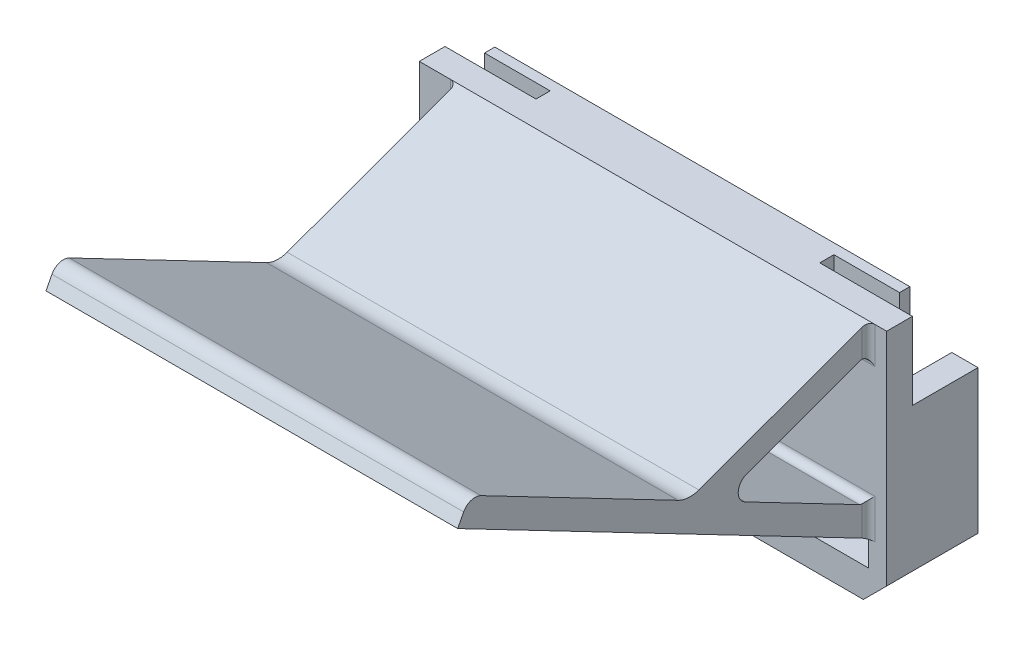
from build123d import *

# Parameters (mm, degrees)
EXTRUDE_1_DEPTH             = 7.1
EXTRUDE_2_DEPTH             = 6
EXTRUDE_2_DIRECTION_2_REACH = 25.469
SKETCH_3_W                  = 32
SKETCH_3_H                  = 2
CUT_EXTRUDE_1_DEPTH         = 36.077992299
SKETCH_4_W                  = 0.599335356
SKETCH_4_H                  = 1.1
EXTRUDE_3_DEPTH             = 4.31849548
EXTRUDE_4_DEPTH             = 32
FILLET_1_R                  = 0.5


with BuildPart() as part:
    # 草图1 → 凸台-拉伸1 (new body)
    with BuildSketch(Plane.XY):
        with BuildLine():
            Line((18.227330455, -16.15), (18.227330455, -27.306853771))
            Line((18.227330455, -27.306853771), (16.416835991, -29.117348235))
            Line((16.416835991, -29.117348235), (5.554207951, -29.117348235))
            Line((5.554207951, -29.117348235), (-15.781834721, -29.117348235))
            Line((-15.781834721, -29.117348235), (-18.100330201, -26.798852755))
            Line((-18.100330201, -26.798852755), (-18.100330201, -16.15))
            Line((-18.100330201, -16.15), (-15.809499619, -16.15))
            Line((-15.809499619, -16.15), (-15.809499619, -25.798852755))
            ThreePointArc((-15.809499619, -25.798852755), (-15.5166064, -26.505959536), (-14.809499619, -26.798852755))
            Line((-14.809499619, -26.798852755), (15.190500381, -26.798852755))
            ThreePointArc((15.190500381, -26.798852755), (15.897607162, -26.505959536), (16.190500381, -25.798852755))
            Line((16.190500381, -25.798852755), (16.190500381, -16.15))
            Line((16.190500381, -16.15), (18.227330455, -16.15))
        make_face()
    extrude(amount=EXTRUDE_1_DEPTH)

    # 草图2 → 凸台-拉伸2 (add)
    with BuildSketch(Plane(origin=(0, -16.15, 0), x_dir=(1, 0, 0), z_dir=(0, 1, 0))):
        Polygon((16.127330455, -4.000000069), (16.127330455, -3.200000069), (-16.127758191, -3.200000069), (-16.127758191, -4), (-11.027330455, -4), (-11.027330455, -5.1), (-18.100330201, -5.1), (-18.100330201, -7.1), (18.227330455, -7.1), (18.227330455, -5.100000069), (11.027330455, -5.100000069), (11.027330455, -4.000000069), align=None)
    extrude(amount=EXTRUDE_2_DEPTH)

    # 草图2 → 凸台-拉伸2 direction 2 (add, up to next)
    with BuildSketch(Plane(origin=(0, -16.15, 0), x_dir=(1, 0, 0), z_dir=(0, 1, 0)), mode=Mode.PRIVATE) as extrude_2_direction_2_sk1:
        Polygon((16.127330455, -4.000000069), (16.127330455, -3.200000069), (-16.127758191, -3.200000069), (-16.127758191, -4), (-11.027330455, -4), (-11.027330455, -5.1), (-18.100330201, -5.1), (-18.100330201, -7.1), (18.227330455, -7.1), (18.227330455, -5.100000069), (11.027330455, -5.100000069), (11.027330455, -4.000000069), align=None)
    extrude_2_direction_2_tool1 = extrude(extrude_2_direction_2_sk1.sketch, amount=-EXTRUDE_2_DIRECTION_2_REACH, mode=Mode.PRIVATE) - part.part
    add(extrude_2_direction_2_tool1.solids().sort_by_distance((0.03755, -16.15, 5.267913))[0])

    # 草图3 → 切除-拉伸1 (cut, through all)
    with BuildSketch(Plane.XY.offset(7.1)):
        with Locations((0.817500635, -25.798852755)):
            Rectangle(SKETCH_3_W, SKETCH_3_H)
    extrude(amount=-CUT_EXTRUDE_1_DEPTH, mode=Mode.SUBTRACT)

    # 草图4 → 凸台-拉伸3 (add)
    with BuildSketch(Plane.XZ.offset(29.117348235)):
        with Locations((-15.482167043, 4.55)):
            Rectangle(SKETCH_4_W, SKETCH_4_H)
    extrude(amount=-EXTRUDE_3_DEPTH)

    # 草图5 → 凸台-拉伸4 (add)
    with BuildSketch(Plane(origin=(-15.182499365, 0, 0), x_dir=(0, 0, -1), z_dir=(1, 0, 0))):
        with BuildLine():
            Line((-7.1, -24.798852755), (-39.032389994, -8.175902679))
            Line((-39.032389994, -8.175902679), (-38.570641381, -7.288891846))
            ThreePointArc((-38.570641381, -7.288891846), (-37.984336348, -6.796923508), (-37.221881935, -6.863629626))
            Line((-37.221881935, -6.863629626), (-21.892534432, -14.843582842))
            ThreePointArc((-21.892534432, -14.843582842), (-21.099843464, -15.065279022), (-20.284996919, -14.948946417))
            Line((-20.284996919, -14.948946417), (-7.1, -10.15))
            Line((-7.1, -10.15), (-7.1, -12.278355545))
            Line((-7.1, -12.278355545), (-16.570152711, -15.725209246))
            ThreePointArc((-16.570152711, -15.725209246), (-17.225991491, -16.599498737), (-16.689881181, -17.5519127))
            Line((-16.689881181, -17.5519127), (-7.1, -22.544088861))
            Line((-7.1, -22.544088861), (-7.1, -24.798852755))
        make_face()
    extrude(amount=EXTRUDE_4_DEPTH)

    # 圆角1
    # the kernel refuses this fillet: 0.5 mm, written as the material it adds along each edge
    with BuildSketch(Plane(origin=(-15.182499365, -21.294088861, 7.1), x_dir=(-1, 0, 0), z_dir=(0, -1, 0))) as fillet_1_piece_1_section:
        with BuildLine():
            CenterArc((FILLET_1_R, -FILLET_1_R), FILLET_1_R, 90, 90)
            Line((0, -FILLET_1_R), (-FILLET_1_R * 0.02, -FILLET_1_R))
            Line((-FILLET_1_R * 0.02, -FILLET_1_R), (-FILLET_1_R * 0.02, FILLET_1_R * 0.02))
            Line((-FILLET_1_R * 0.02, FILLET_1_R * 0.02), (FILLET_1_R, FILLET_1_R * 0.02))
            Line((FILLET_1_R, FILLET_1_R * 0.02), (FILLET_1_R, 0))
        make_face()
    fillet_1_piece_1 = extrude(amount=4.754763894, mode=Mode.PRIVATE)
    fillet_1_piece_1 = split(fillet_1_piece_1, bisect_by=Plane(origin=(-15.182499365, -23.618510105, 7.201736565), z_dir=(-1, 0, 0)), keep=Keep.TOP, mode=Mode.PRIVATE)
    fillet_1_piece_1 = split(fillet_1_piece_1, bisect_by=Plane(origin=(-15.30597489, -24.505520938, 7.663485178), z_dir=(0, 0.8870108331782195, -0.46174861323503813)), keep=Keep.TOP, mode=Mode.PRIVATE)
    fillet_1_piece_1 = split(fillet_1_piece_1, bisect_by=Plane(origin=(-15.30597489, -22.731499272, 6.739987952), z_dir=(0, -0.8870108331782195, 0.4617486132350387)), keep=Keep.TOP, mode=Mode.PRIVATE)
    add(fillet_1_piece_1)
    with BuildSketch(Plane(origin=(-15.182499365, -22.544088861, 7.1), x_dir=(0, 1, 0), z_dir=(1, 0, 0))) as fillet_1_piece_2:
        with BuildLine():
            CenterArc((FILLET_1_R * 1.64794899742, FILLET_1_R), FILLET_1_R, 152.5, 117.5)
            Line((FILLET_1_R * 0.76093816424, FILLET_1_R * 1.46174861324), (FILLET_1_R * 0.743197947576, FILLET_1_R * 1.4709835855))
            Line((FILLET_1_R * 0.743197947576, FILLET_1_R * 1.4709835855), (-FILLET_1_R * 0.0329589799484, -FILLET_1_R * 0.02))
            Line((-FILLET_1_R * 0.0329589799484, -FILLET_1_R * 0.02), (FILLET_1_R * 1.64794899742, -FILLET_1_R * 0.02))
            Line((FILLET_1_R * 1.64794899742, -FILLET_1_R * 0.02), (FILLET_1_R * 1.64794899742, 0))
        make_face()
    extrude(amount=32)
    with BuildSketch(Plane(origin=(-15.182499365, -12.278355545, 7.1), x_dir=(0, -1, 0), z_dir=(1, 0, 0))) as fillet_1_piece_3:
        with BuildLine():
            CenterArc((FILLET_1_R * 1.42814800674, -FILLET_1_R), FILLET_1_R, 90, 110)
            Line((FILLET_1_R * 0.488455385956, -FILLET_1_R * 1.34202014333), (FILLET_1_R * 0.46966153354, -FILLET_1_R * 1.34886054619))
            Line((FILLET_1_R * 0.46966153354, -FILLET_1_R * 1.34886054619), (-FILLET_1_R * 0.0285629601348, FILLET_1_R * 0.02))
            Line((-FILLET_1_R * 0.0285629601348, FILLET_1_R * 0.02), (FILLET_1_R * 1.42814800674, FILLET_1_R * 0.02))
            Line((FILLET_1_R * 1.42814800674, FILLET_1_R * 0.02), (FILLET_1_R * 1.42814800674, 0))
        make_face()
    extrude(amount=32)
    with BuildSketch(Plane(origin=(-15.182499365, -10.15, 7.1), x_dir=(-1, 0, 0), z_dir=(0, -1, 0))) as fillet_1_piece_4_section:
        with BuildLine():
            CenterArc((FILLET_1_R, -FILLET_1_R), FILLET_1_R, 90, 90)
            Line((0, -FILLET_1_R), (-FILLET_1_R * 0.02, -FILLET_1_R))
            Line((-FILLET_1_R * 0.02, -FILLET_1_R), (-FILLET_1_R * 0.02, FILLET_1_R * 0.02))
            Line((-FILLET_1_R * 0.02, FILLET_1_R * 0.02), (FILLET_1_R, FILLET_1_R * 0.02))
            Line((FILLET_1_R, FILLET_1_R * 0.02), (FILLET_1_R, 0))
        make_face()
    fillet_1_piece_4 = extrude(amount=3.378355545, mode=Mode.PRIVATE)
    fillet_1_piece_4 = split(fillet_1_piece_4, bisect_by=Plane(origin=(-15.295687906, -12.195082425, 6.871208984), z_dir=(0, 0.9396926207859094, 0.34202014332566616)), keep=Keep.TOP, mode=Mode.PRIVATE)
    fillet_1_piece_4 = split(fillet_1_piece_4, bisect_by=Plane(origin=(-15.295687906, -10.315697184, 7.55524927), z_dir=(0, -0.9396926207859093, -0.34202014332566627)), keep=Keep.TOP, mode=Mode.PRIVATE)
    add(fillet_1_piece_4)
    with BuildSketch(Plane(origin=(16.817500635, -21.294088861, 7.1), x_dir=(1, 0, 0), z_dir=(0, -1, 0))) as fillet_1_piece_5_section:
        with BuildLine():
            CenterArc((FILLET_1_R, FILLET_1_R), FILLET_1_R, 180, 90)
            Line((0, FILLET_1_R), (-FILLET_1_R * 0.02, FILLET_1_R))
            Line((-FILLET_1_R * 0.02, FILLET_1_R), (-FILLET_1_R * 0.02, -FILLET_1_R * 0.02))
            Line((-FILLET_1_R * 0.02, -FILLET_1_R * 0.02), (FILLET_1_R, -FILLET_1_R * 0.02))
            Line((FILLET_1_R, -FILLET_1_R * 0.02), (FILLET_1_R, 0))
        make_face()
    fillet_1_piece_5 = extrude(amount=4.754763894, mode=Mode.PRIVATE)
    fillet_1_piece_5 = split(fillet_1_piece_5, bisect_by=Plane(origin=(16.817500635, -23.618510105, 7.201736565), z_dir=(1, 0, 0)), keep=Keep.TOP, mode=Mode.PRIVATE)
    fillet_1_piece_5 = split(fillet_1_piece_5, bisect_by=Plane(origin=(16.94097616, -24.505520938, 7.663485178), z_dir=(0, 0.8870108331782195, -0.46174861323503813)), keep=Keep.TOP, mode=Mode.PRIVATE)
    fillet_1_piece_5 = split(fillet_1_piece_5, bisect_by=Plane(origin=(16.94097616, -22.731499272, 6.739987952), z_dir=(0, -0.8870108331782195, 0.4617486132350387)), keep=Keep.TOP, mode=Mode.PRIVATE)
    add(fillet_1_piece_5)
    with BuildSketch(Plane(origin=(16.817500635, -10.15, 7.1), x_dir=(1, 0, 0), z_dir=(0, -1, 0))) as fillet_1_piece_6_section:
        with BuildLine():
            CenterArc((FILLET_1_R, FILLET_1_R), FILLET_1_R, 180, 90)
            Line((0, FILLET_1_R), (-FILLET_1_R * 0.02, FILLET_1_R))
            Line((-FILLET_1_R * 0.02, FILLET_1_R), (-FILLET_1_R * 0.02, -FILLET_1_R * 0.02))
            Line((-FILLET_1_R * 0.02, -FILLET_1_R * 0.02), (FILLET_1_R, -FILLET_1_R * 0.02))
            Line((FILLET_1_R, -FILLET_1_R * 0.02), (FILLET_1_R, 0))
        make_face()
    fillet_1_piece_6 = extrude(amount=3.378355545, mode=Mode.PRIVATE)
    fillet_1_piece_6 = split(fillet_1_piece_6, bisect_by=Plane(origin=(16.930689176, -10.315697184, 7.55524927), z_dir=(0, -0.9396926207859093, -0.34202014332566627)), keep=Keep.TOP, mode=Mode.PRIVATE)
    fillet_1_piece_6 = split(fillet_1_piece_6, bisect_by=Plane(origin=(16.930689176, -12.195082425, 6.871208984), z_dir=(0, 0.9396926207859094, 0.34202014332566616)), keep=Keep.TOP, mode=Mode.PRIVATE)
    add(fillet_1_piece_6)
    with BuildSketch(Plane(origin=(-15.182499365, -21.294088861, 7.1), x_dir=(-1, 0, 0), z_dir=(0, -1, 0))) as fillet_1_piece_7a_section:
        with BuildLine():
            CenterArc((FILLET_1_R, -FILLET_1_R), FILLET_1_R, 90, 90)
            Line((0, -FILLET_1_R), (-FILLET_1_R * 0.02, -FILLET_1_R))
            Line((-FILLET_1_R * 0.02, -FILLET_1_R), (-FILLET_1_R * 0.02, FILLET_1_R * 0.02))
            Line((-FILLET_1_R * 0.02, FILLET_1_R * 0.02), (FILLET_1_R, FILLET_1_R * 0.02))
            Line((FILLET_1_R, FILLET_1_R * 0.02), (FILLET_1_R, 0))
        make_face()
    fillet_1_piece_7a = extrude(amount=4.754763894, mode=Mode.PRIVATE)
    fillet_1_piece_7a = split(fillet_1_piece_7a, bisect_by=Plane(origin=(-15.182499365, -21.893638872, 7.197777948), z_dir=(-1, 0, 0)), keep=Keep.TOP, mode=Mode.PRIVATE)
    fillet_1_piece_7a = split(fillet_1_piece_7a, bisect_by=Plane(origin=(-15.308579206, -22.365357757, 7.443339257), z_dir=(0, 0.8870108331782195, -0.4617486132350387)), keep=Keep.TOP, mode=Mode.PRIVATE)
    with BuildSketch(Plane(origin=(-17.242435612, -22.544088861, 7.1), x_dir=(0, 1, 0), z_dir=(1, 0, 0))) as fillet_1_piece_7b_section:
        with BuildLine():
            CenterArc((FILLET_1_R * 1.64794899742, FILLET_1_R), FILLET_1_R, 152.5, 117.5)
            Line((FILLET_1_R * 0.76093816424, FILLET_1_R * 1.46174861324), (FILLET_1_R * 0.743197947576, FILLET_1_R * 1.4709835855))
            Line((FILLET_1_R * 0.743197947576, FILLET_1_R * 1.4709835855), (-FILLET_1_R * 0.0329589799484, -FILLET_1_R * 0.02))
            Line((-FILLET_1_R * 0.0329589799484, -FILLET_1_R * 0.02), (FILLET_1_R * 1.64794899742, -FILLET_1_R * 0.02))
            Line((FILLET_1_R * 1.64794899742, -FILLET_1_R * 0.02), (FILLET_1_R * 1.64794899742, 0))
        make_face()
    fillet_1_piece_7b = extrude(amount=34.059936247, mode=Mode.PRIVATE)
    fillet_1_piece_7b = split(fillet_1_piece_7b, bisect_by=Plane(origin=(-15.182499365, -22.251163965, 7.277751191), z_dir=(-1, 0, 0)), keep=Keep.TOP, mode=Mode.PRIVATE)
    fillet_1_piece_7 = fillet_1_piece_7a & fillet_1_piece_7b
    add(fillet_1_piece_7)
    with BuildSketch(Plane(origin=(-15.182499365, -22.544088861, 7.1), x_dir=(0, 1, 0), z_dir=(1, 0, 0))) as fillet_1_piece_8a_section:
        with BuildLine():
            CenterArc((FILLET_1_R * 1.64794899742, FILLET_1_R), FILLET_1_R, 152.5, 117.5)
            Line((FILLET_1_R * 0.76093816424, FILLET_1_R * 1.46174861324), (FILLET_1_R * 0.743197947576, FILLET_1_R * 1.4709835855))
            Line((FILLET_1_R * 0.743197947576, FILLET_1_R * 1.4709835855), (-FILLET_1_R * 0.0329589799484, -FILLET_1_R * 0.02))
            Line((-FILLET_1_R * 0.0329589799484, -FILLET_1_R * 0.02), (FILLET_1_R * 1.64794899742, -FILLET_1_R * 0.02))
            Line((FILLET_1_R * 1.64794899742, -FILLET_1_R * 0.02), (FILLET_1_R * 1.64794899742, 0))
        make_face()
    fillet_1_piece_8a = extrude(amount=34.059936247, mode=Mode.PRIVATE)
    fillet_1_piece_8a = split(fillet_1_piece_8a, bisect_by=Plane(origin=(16.817500635, -22.251163965, 7.277751191), z_dir=(1, 0, 0)), keep=Keep.TOP, mode=Mode.PRIVATE)
    with BuildSketch(Plane(origin=(16.817500635, -21.294088861, 7.1), x_dir=(1, 0, 0), z_dir=(0, -1, 0))) as fillet_1_piece_8b_section:
        with BuildLine():
            CenterArc((FILLET_1_R, FILLET_1_R), FILLET_1_R, 180, 90)
            Line((0, FILLET_1_R), (-FILLET_1_R * 0.02, FILLET_1_R))
            Line((-FILLET_1_R * 0.02, FILLET_1_R), (-FILLET_1_R * 0.02, -FILLET_1_R * 0.02))
            Line((-FILLET_1_R * 0.02, -FILLET_1_R * 0.02), (FILLET_1_R, -FILLET_1_R * 0.02))
            Line((FILLET_1_R, -FILLET_1_R * 0.02), (FILLET_1_R, 0))
        make_face()
    fillet_1_piece_8b = extrude(amount=4.754763894, mode=Mode.PRIVATE)
    fillet_1_piece_8b = split(fillet_1_piece_8b, bisect_by=Plane(origin=(16.817500635, -21.893638872, 7.197777948), z_dir=(1, 0, 0)), keep=Keep.TOP, mode=Mode.PRIVATE)
    fillet_1_piece_8b = split(fillet_1_piece_8b, bisect_by=Plane(origin=(16.943580476, -22.365357757, 7.443339257), z_dir=(0, 0.8870108331782195, -0.4617486132350387)), keep=Keep.TOP, mode=Mode.PRIVATE)
    fillet_1_piece_8 = fillet_1_piece_8a & fillet_1_piece_8b
    add(fillet_1_piece_8)
    with BuildSketch(Plane(origin=(-16.967684373, -12.278355545, 7.1), x_dir=(0, -1, 0), z_dir=(1, 0, 0))) as fillet_1_piece_9a_section:
        with BuildLine():
            CenterArc((FILLET_1_R * 1.42814800674, -FILLET_1_R), FILLET_1_R, 90, 110)
            Line((FILLET_1_R * 0.488455385956, -FILLET_1_R * 1.34202014333), (FILLET_1_R * 0.46966153354, -FILLET_1_R * 1.34886054619))
            Line((FILLET_1_R * 0.46966153354, -FILLET_1_R * 1.34886054619), (-FILLET_1_R * 0.0285629601348, FILLET_1_R * 0.02))
            Line((-FILLET_1_R * 0.0285629601348, FILLET_1_R * 0.02), (FILLET_1_R * 1.42814800674, FILLET_1_R * 0.02))
            Line((FILLET_1_R * 1.42814800674, FILLET_1_R * 0.02), (FILLET_1_R * 1.42814800674, 0))
        make_face()
    fillet_1_piece_9a = extrude(amount=33.785185008, mode=Mode.PRIVATE)
    fillet_1_piece_9a = split(fillet_1_piece_9a, bisect_by=Plane(origin=(-15.182499365, -12.506130836, 7.259489976), z_dir=(-1, 0, 0)), keep=Keep.TOP, mode=Mode.PRIVATE)
    with BuildSketch(Plane(origin=(-15.182499365, -10.15, 7.1), x_dir=(-1, 0, 0), z_dir=(0, -1, 0))) as fillet_1_piece_9b_section:
        with BuildLine():
            CenterArc((FILLET_1_R, -FILLET_1_R), FILLET_1_R, 90, 90)
            Line((0, -FILLET_1_R), (-FILLET_1_R * 0.02, -FILLET_1_R))
            Line((-FILLET_1_R * 0.02, -FILLET_1_R), (-FILLET_1_R * 0.02, FILLET_1_R * 0.02))
            Line((-FILLET_1_R * 0.02, FILLET_1_R * 0.02), (FILLET_1_R, FILLET_1_R * 0.02))
            Line((FILLET_1_R, FILLET_1_R * 0.02), (FILLET_1_R, 0))
        make_face()
    fillet_1_piece_9b = extrude(amount=3.378355545, mode=Mode.PRIVATE)
    fillet_1_piece_9b = split(fillet_1_piece_9b, bisect_by=Plane(origin=(-15.29776373, -12.389058539, 7.404153976), z_dir=(0, -0.9396926207859094, -0.34202014332566616)), keep=Keep.TOP, mode=Mode.PRIVATE)
    fillet_1_piece_9 = fillet_1_piece_9a & fillet_1_piece_9b
    add(fillet_1_piece_9)
    with BuildSketch(Plane(origin=(16.817500635, -10.15, 7.1), x_dir=(1, 0, 0), z_dir=(0, -1, 0))) as fillet_1_piece_10a_section:
        with BuildLine():
            CenterArc((FILLET_1_R, FILLET_1_R), FILLET_1_R, 180, 90)
            Line((0, FILLET_1_R), (-FILLET_1_R * 0.02, FILLET_1_R))
            Line((-FILLET_1_R * 0.02, FILLET_1_R), (-FILLET_1_R * 0.02, -FILLET_1_R * 0.02))
            Line((-FILLET_1_R * 0.02, -FILLET_1_R * 0.02), (FILLET_1_R, -FILLET_1_R * 0.02))
            Line((FILLET_1_R, -FILLET_1_R * 0.02), (FILLET_1_R, 0))
        make_face()
    fillet_1_piece_10a = extrude(amount=3.378355545, mode=Mode.PRIVATE)
    fillet_1_piece_10a = split(fillet_1_piece_10a, bisect_by=Plane(origin=(16.932765, -12.389058539, 7.404153976), z_dir=(0, -0.9396926207859094, -0.34202014332566616)), keep=Keep.TOP, mode=Mode.PRIVATE)
    with BuildSketch(Plane(origin=(-15.182499365, -12.278355545, 7.1), x_dir=(0, -1, 0), z_dir=(1, 0, 0))) as fillet_1_piece_10b_section:
        with BuildLine():
            CenterArc((FILLET_1_R * 1.42814800674, -FILLET_1_R), FILLET_1_R, 90, 110)
            Line((FILLET_1_R * 0.488455385956, -FILLET_1_R * 1.34202014333), (FILLET_1_R * 0.46966153354, -FILLET_1_R * 1.34886054619))
            Line((FILLET_1_R * 0.46966153354, -FILLET_1_R * 1.34886054619), (-FILLET_1_R * 0.0285629601348, FILLET_1_R * 0.02))
            Line((-FILLET_1_R * 0.0285629601348, FILLET_1_R * 0.02), (FILLET_1_R * 1.42814800674, FILLET_1_R * 0.02))
            Line((FILLET_1_R * 1.42814800674, FILLET_1_R * 0.02), (FILLET_1_R * 1.42814800674, 0))
        make_face()
    fillet_1_piece_10b = extrude(amount=33.785185008, mode=Mode.PRIVATE)
    fillet_1_piece_10b = split(fillet_1_piece_10b, bisect_by=Plane(origin=(16.817500635, -12.506130836, 7.259489976), z_dir=(1, 0, 0)), keep=Keep.TOP, mode=Mode.PRIVATE)
    fillet_1_piece_10 = fillet_1_piece_10a & fillet_1_piece_10b
    add(fillet_1_piece_10)
    # the kernel refuses this fillet: 0.5 mm, written as the material it takes off along each edge
    with BuildSketch(Plane(origin=(-15.182499365, -24.798852755, 3.200000069), x_dir=(0, 0, 1), z_dir=(1, 0, 0))) as fillet_1_2_piece_1:
        with BuildLine():
            CenterArc((FILLET_1_R, -FILLET_1_R), FILLET_1_R, 90, 90)
            Line((0, -FILLET_1_R), (-FILLET_1_R * 0.02, -FILLET_1_R))
            Line((-FILLET_1_R * 0.02, -FILLET_1_R), (-FILLET_1_R * 0.02, FILLET_1_R * 0.02))
            Line((-FILLET_1_R * 0.02, FILLET_1_R * 0.02), (FILLET_1_R, FILLET_1_R * 0.02))
            Line((FILLET_1_R, FILLET_1_R * 0.02), (FILLET_1_R, 0))
        make_face()
    extrude(amount=31.30982982, mode=Mode.SUBTRACT)


solid = part.part
